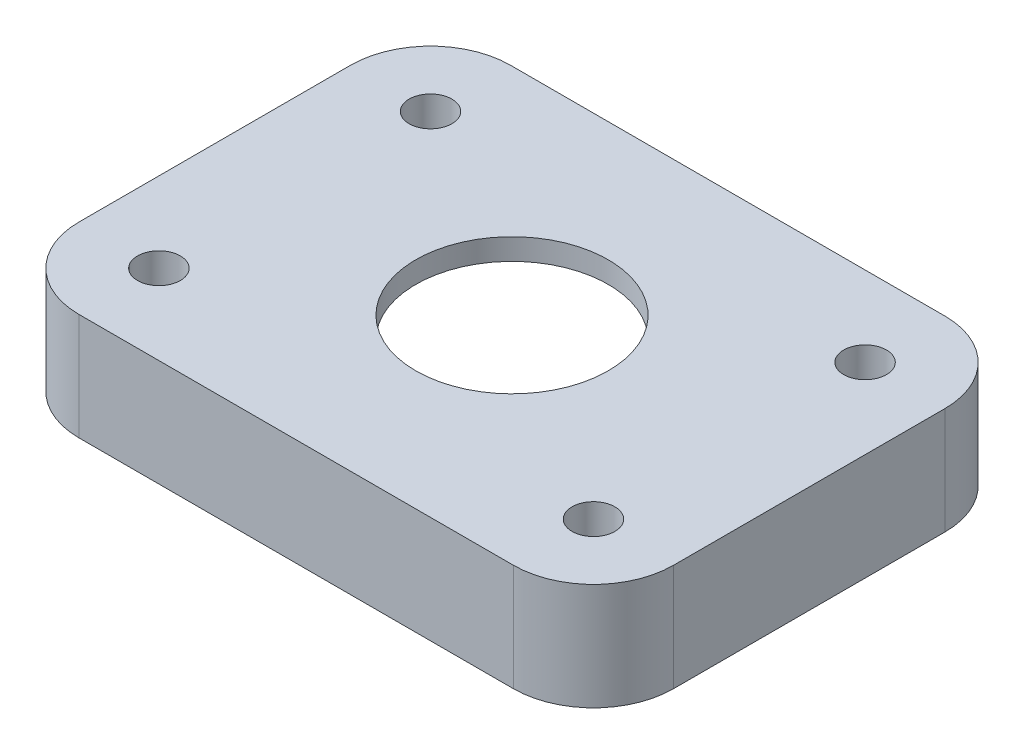
from build123d import *
from build123d.topology import SkipClean

# Parameters (mm, degrees)
BOSS_EXTRUDE1_DEPTH       = 4
BOSS_EXTRUDE2_DEPTH       = 1
BOSS_EXTRUDE3_START       = -0.8
SKETCH4_R                 = 2
SKETCH4_R_2               = 1.25
BOSS_EXTRUDE3_DEPTH       = 3.2
MIRROR4_START             = -0.8
MIRROR4_COPY_1_SKETCH_R   = 2
MIRROR4_COPY_1_SKETCH_R_2 = 1.25
MIRROR4_COPY_1_DEPTH      = 3.2
SKETCH5_R                 = 4.5
CUT_EXTRUDE1_DEPTH        = 3
SKETCH1_R                 = 1.25
CUT_EXTRUDE2_DEPTH        = 10
FILLET2_R                 = 1
EXTRUDE_THIN1_START       = -4.2
SKETCH6_R                 = 2
SKETCH6_R_2               = 1
EXTRUDE_THIN1_DEPTH       = 4.2


with BuildPart() as part:
    # Sketch2 → Boss-Extrude1 (new body)
    with BuildSketch(Plane(origin=(0, 0, 0), x_dir=(1, 0, 0), z_dir=(0, 1, 0))):
        with BuildLine():
            Line((-26.6, 15.24), (-26.6, 2.54))
            ThreePointArc((-26.6, 2.54), (-25.504579362, -0.104579362), (-22.86, -1.2))
            Line((-22.86, -1.2), (-2.54, -1.2))
            ThreePointArc((-2.54, -1.2), (0.104579362, -0.104579362), (1.2, 2.54))
            Line((1.2, 2.54), (1.2, 15.24))
            ThreePointArc((1.2, 15.24), (0.104579362, 17.884579362), (-2.54, 18.98))
            Line((-2.54, 18.98), (-22.86, 18.98))
            ThreePointArc((-22.86, 18.98), (-25.504579362, 17.884579362), (-26.6, 15.24))
        make_face()
        with BuildLine():
            Line((0.2, 2.54), (0.2, 15.24))
            ThreePointArc((0.2, 15.24), (-0.60252742, 17.17747258), (-2.54, 17.98))
            Line((-2.54, 17.98), (-22.86, 17.98))
            ThreePointArc((-22.86, 17.98), (-24.79747258, 17.17747258), (-25.6, 15.24))
            Line((-25.6, 15.24), (-25.6, 2.54))
            ThreePointArc((-25.6, 2.54), (-24.79747258, 0.60252742), (-22.86, -0.2))
            Line((-22.86, -0.2), (-2.54, -0.2))
            ThreePointArc((-2.54, -0.2), (-0.60252742, 0.60252742), (0.2, 2.54))
        make_face(mode=Mode.SUBTRACT)
    extrude(amount=BOSS_EXTRUDE1_DEPTH)

    # Sketch3 → Boss-Extrude2 (add)
    with BuildSketch(Plane(origin=(0, 4, 0), x_dir=(1, 0, 0), z_dir=(0, 1, 0))):
        with BuildLine():
            Line((-26.6, 15.24), (-26.6, 2.54))
            ThreePointArc((-26.6, 2.54), (-25.504579362, -0.104579362), (-22.86, -1.2))
            Line((-22.86, -1.2), (-2.54, -1.2))
            ThreePointArc((-2.54, -1.2), (0.104579362, -0.104579362), (1.2, 2.54))
            Line((1.2, 2.54), (1.2, 15.24))
            ThreePointArc((1.2, 15.24), (0.104579362, 17.884579362), (-2.54, 18.98))
            Line((-2.54, 18.98), (-22.86, 18.98))
            ThreePointArc((-22.86, 18.98), (-25.504579362, 17.884579362), (-26.6, 15.24))
        make_face()
    extrude(amount=BOSS_EXTRUDE2_DEPTH)

    # Sketch4 → Boss-Extrude3 (add)
    # profile 1 of 2: a face of its own
    with BuildSketch(Plane.XZ.offset(BOSS_EXTRUDE3_START)):
        with BuildLine():
            ThreePointArc((-22.86, -4.54), (-24.274213562, -1.125786438), (-20.86, -2.54))
            Line((-20.86, -2.54), (-20.86, 0.2))
            Line((-20.86, 0.2), (-22.86, 0.2))
            ThreePointArc((-22.86, 0.2), (-24.79747258, -0.60252742), (-25.6, -2.54))
            Line((-25.6, -2.54), (-25.6, -4.54))
            Line((-25.6, -4.54), (-22.86, -4.54))
        make_face()
    # profile 2 of 2: a face of its own
    with BuildSketch(Plane.XZ.offset(BOSS_EXTRUDE3_START)):
        with Locations((-22.86, -2.54)):
            Circle(SKETCH4_R)
        with Locations(Location((-22.86, -2.54, 0), (0, 0, 90))):
            Circle(SKETCH4_R_2, mode=Mode.SUBTRACT)
    boss_extrude3 = extrude(amount=-BOSS_EXTRUDE3_DEPTH)

    # Mirror3: Boss-Extrude3 across plane
    add(boss_extrude3.mirror(Plane.ZY.offset(12.7)))

    # Mirror4: Boss-Extrude3 across plane
    add(boss_extrude3.mirror(Plane(origin=(0, 0, -8.89), x_dir=(1, 0, 0), z_dir=(0, 0, -1))))

    # Mirror4 copy 1 sketch → Mirror4 copy 1 (add)
    # profile 1 of 2: a face of its own
    with BuildSketch(Plane(origin=(-25.4, 0, -17.78), x_dir=(-1, 0, 0), z_dir=(0, -1, 0)).offset(MIRROR4_START)):
        with BuildLine():
            ThreePointArc((-22.86, -4.54), (-24.274213562, -1.125786438), (-20.86, -2.54))
            Line((-20.86, -2.54), (-20.86, 0.2))
            Line((-20.86, 0.2), (-22.86, 0.2))
            ThreePointArc((-22.86, 0.2), (-24.79747258, -0.60252742), (-25.6, -2.54))
            Line((-25.6, -2.54), (-25.6, -4.54))
            Line((-25.6, -4.54), (-22.86, -4.54))
        make_face()
    # profile 2 of 2: a face of its own
    with BuildSketch(Plane(origin=(-25.4, 0, -17.78), x_dir=(-1, 0, 0), z_dir=(0, -1, 0)).offset(MIRROR4_START)):
        with Locations((-22.86, -2.54)):
            Circle(MIRROR4_COPY_1_SKETCH_R)
        with Locations(Location((-22.86, -2.54, 0), (0, 0, 90))):
            Circle(MIRROR4_COPY_1_SKETCH_R_2, mode=Mode.SUBTRACT)
    extrude(amount=-MIRROR4_COPY_1_DEPTH)

    # Sketch5 → Cut-Extrude1 (cut)
    with BuildSketch(Plane(origin=(0, 5, 0), x_dir=(1, 0, 0), z_dir=(0, 1, 0))):
        with Locations(Location((-12.7, 8.89, 0), (0, 0, 270))):
            Circle(SKETCH5_R)
    extrude(amount=-CUT_EXTRUDE1_DEPTH, mode=Mode.SUBTRACT)

    # Sketch1 → Cut-Extrude2 (cut)
    with SkipClean():  # the faces are left unmerged after this step: merging them gives an invalid solid
        with BuildSketch(Plane(origin=(0, 0, 0), x_dir=(1, 0, 0), z_dir=(0, 1, 0))):
            with Locations(Location((-22.86, 2.54, 0), (0, 0, 270))):
                Circle(SKETCH1_R)
            with Locations(Location((-2.54, 2.54, 0), (0, 0, 270))):
                Circle(SKETCH1_R)
            with Locations(Location((-2.54, 15.24, 0), (0, 0, 270))):
                Circle(SKETCH1_R)
            with Locations(Location((-22.86, 15.24, 0), (0, 0, 270))):
                Circle(SKETCH1_R)
        extrude(amount=CUT_EXTRUDE2_DEPTH, mode=Mode.SUBTRACT)
    add(part.part.scale(1), mode=Mode.REPLACE)  # the faces are merged on a copy

    # Fillet2
    fillet2_edges = [part.edges().sort_by_distance(p)[0] for p in [
        (-4.54, 2.4, 0.2),
        (0.2, 2.4, -4.54),
        (0.2, 2.4, -13.24),
        (-4.54, 2.4, -17.98),
        (-20.86, 2.4, -17.98),
        (-25.6, 2.4, -13.24),
        (-25.6, 2.4, -4.54),
        (-20.86, 2.4, 0.2),
    ]]
    fillet(fillet2_edges, radius=FILLET2_R)

    # Sketch6 → Extrude-Thin1 (add)
    # profile 1 of 4: a face of its own
    with BuildSketch(Plane(origin=(0, 5, 0), x_dir=(1, 0, 0), z_dir=(0, 1, 0)).offset(EXTRUDE_THIN1_START)):
        with Locations((-2.54, 15.24)):
            Circle(SKETCH6_R)
        with Locations((-2.54, 15.24)):
            Circle(SKETCH6_R_2, mode=Mode.SUBTRACT)
    # profile 2 of 4: a face of its own
    with BuildSketch(Plane(origin=(0, 5, 0), x_dir=(1, 0, 0), z_dir=(0, 1, 0)).offset(EXTRUDE_THIN1_START)):
        with Locations((-22.86, 15.24)):
            Circle(SKETCH6_R)
        with Locations((-22.86, 15.24)):
            Circle(SKETCH6_R_2, mode=Mode.SUBTRACT)
    # profile 3 of 4: a face of its own
    with BuildSketch(Plane(origin=(0, 5, 0), x_dir=(1, 0, 0), z_dir=(0, 1, 0)).offset(EXTRUDE_THIN1_START)):
        with Locations((-2.54, 2.54)):
            Circle(SKETCH6_R)
        with Locations((-2.54, 2.54)):
            Circle(SKETCH6_R_2, mode=Mode.SUBTRACT)
    # profile 4 of 4: a face of its own
    with BuildSketch(Plane(origin=(0, 5, 0), x_dir=(1, 0, 0), z_dir=(0, 1, 0)).offset(EXTRUDE_THIN1_START)):
        with Locations((-22.86, 2.54)):
            Circle(SKETCH6_R)
        with Locations((-22.86, 2.54)):
            Circle(SKETCH6_R_2, mode=Mode.SUBTRACT)
    extrude(amount=EXTRUDE_THIN1_DEPTH)


solid = part.part
